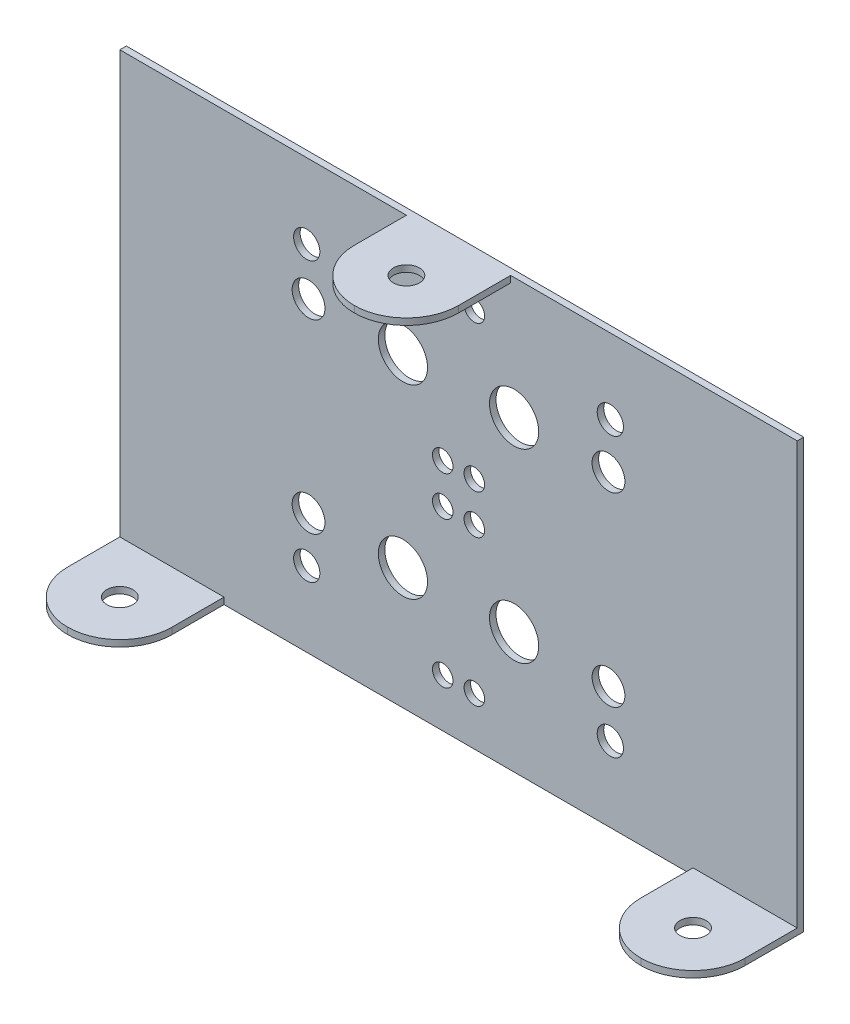
from build123d import *

# Parameters (mm, degrees)
SKETCH1_R             = 1.5875
BOSS_EXTRUDE1_DEPTH   = 1.5875
SKETCH1_W             = 12.7
SKETCH1_H             = 12.7
BOSS_EXTRUDE1_2_DEPTH = 1.5875
SKETCH2_W             = 69.85
SKETCH2_H             = 53
BOSS_EXTRUDE2_DEPTH   = 1.5875
BOSS_EXTRUDE3_DEPTH   = 1.5875
SKETCH6_W             = 1.5875
SKETCH6_H             = 53
BOSS_EXTRUDE4_DEPTH   = 12.7
SKETCH7_W             = 12.7
SKETCH7_H             = 12.7
CUT_EXTRUDE1_DEPTH    = 12.7
SKETCH10_W            = 13.49375
SKETCH10_H            = 0.79375
CUT_EXTRUDE3_DEPTH    = 100.134429722
SKETCH13_R            = 1.25
SKETCH13_R_2          = 3
SKETCH13_R_3          = 2.000000064
CUT_EXTRUDE4_DEPTH    = 12.7
FILLET1_R             = 6.35
FILLET2_R             = 6.35
SKETCH14_W            = 12.7
SKETCH14_H            = 12.7
SKETCH14_R            = 1.5875
BOSS_EXTRUDE5_DEPTH   = 0.79375
FILLET3_R             = 6.35
SKETCH15_R            = 1.6
CUT_EXTRUDE7_DEPTH    = 0.79375


with BuildPart() as part:
    # Sketch1 → Boss-Extrude1 (new body)
    with BuildSketch(Plane(origin=(0, 0, 0), x_dir=(1, 0, 0), z_dir=(0, 1, 0))):
        Polygon((-12.7, 0), (0, 0), (0, 12.7), (-12.7, 12.7), (-12.7, 6.35), align=None)
        with Locations(Location((-6.35, 6.35, 0), (0, 0, 270))):
            Circle(SKETCH1_R, mode=Mode.SUBTRACT)
    extrude(amount=BOSS_EXTRUDE1_DEPTH)



with BuildPart() as body_2:
    # Sketch1 → Boss-Extrude1 2 (new body)
    with BuildSketch(Plane(origin=(0, 0, 0), x_dir=(1, 0, 0), z_dir=(0, 1, 0))):
        with Locations((-63.5, 6.35)):
            Rectangle(SKETCH1_W, SKETCH1_H)
        with Locations(Location((-63.5, 6.35, 0), (0, 0, 270))):
            Circle(SKETCH1_R, mode=Mode.SUBTRACT)
    extrude(amount=BOSS_EXTRUDE1_2_DEPTH)


with BuildPart() as part_1:
    add(part.part)

    add(body_2.part)  # Boss-Extrude2 merges body 2
    # Sketch2 → Boss-Extrude2 (add)
    with BuildSketch(Plane(origin=(0, 0, -12.7), x_dir=(-1, 0, 0), z_dir=(0, 0, -1))):
        with Locations((34.925, 26.5)):
            Rectangle(SKETCH2_W, SKETCH2_H)
    extrude(amount=BOSS_EXTRUDE2_DEPTH)

    # Sketch5 → Boss-Extrude3 (add)
    with BuildSketch(Plane(origin=(0, 1.5875, 0), x_dir=(1, 0, 0), z_dir=(0, 1, 0))):
        with BuildLine():
            Line((-69.85, 0), (-69.85, 6.35))
            Line((-69.85, 6.35), (-74.6125, 6.35))
            ThreePointArc((-74.6125, 6.35), (-76.2, 4.7625), (-77.7875, 6.35))
            Line((-77.7875, 6.35), (-82.55, 6.35))
            Line((-82.55, 6.35), (-82.55, 0))
            Line((-82.55, 0), (-69.85, 0))
        make_face()
        with BuildLine():
            ThreePointArc((-77.7875, 6.35), (-77.322532015, 7.472532015), (-76.2, 7.9375))
            Line((-76.2, 7.9375), (-76.2, 12.7))
            Line((-76.2, 12.7), (-82.55, 12.7))
            Line((-82.55, 12.7), (-82.55, 6.35))
            Line((-82.55, 6.35), (-77.7875, 6.35))
        make_face()
        with BuildLine():
            Line((-74.6125, 6.35), (-69.85, 6.35))
            Line((-69.85, 6.35), (-69.85, 12.7))
            Line((-69.85, 12.7), (-76.2, 12.7))
            Line((-76.2, 12.7), (-76.2, 7.9375))
            ThreePointArc((-76.2, 7.9375), (-75.077467985, 7.472532015), (-74.6125, 6.35))
        make_face()
    extrude(amount=-BOSS_EXTRUDE3_DEPTH)

    # Sketch6 → Boss-Extrude4 (add)
    with BuildSketch(Plane.ZY.offset(69.85)):
        with Locations((-13.49375, 26.5)):
            Rectangle(SKETCH6_W, SKETCH6_H)
    extrude(amount=BOSS_EXTRUDE4_DEPTH)

    # Sketch7 → Cut-Extrude1 (cut)
    with BuildSketch(Plane(origin=(0, 1.5875, 0), x_dir=(1, 0, 0), z_dir=(0, 1, 0))):
        with Locations((-63.5, 6.35)):
            Rectangle(SKETCH7_W, SKETCH7_H)
    extrude(amount=-CUT_EXTRUDE1_DEPTH, mode=Mode.SUBTRACT)

    # Sketch10 → Cut-Extrude3 (cut, through all)
    with BuildSketch(Plane(origin=(0, 0, 0), x_dir=(0, 0, -1), z_dir=(1, 0, 0))):
        with Locations((6.746875, 0.396875)):
            Rectangle(SKETCH10_W, SKETCH10_H)
        Polygon((13.49375, 0.79375), (13.49375, 0), (14.2875, 0), (14.2875, 53), (13.49375, 53), align=None)
    extrude(amount=-CUT_EXTRUDE3_DEPTH, mode=Mode.SUBTRACT)

    # Sketch13 → Cut-Extrude4 (cut)
    with BuildSketch(Plane(origin=(0, 0, -13.49375), x_dir=(-1, 0, 0), z_dir=(0, 0, -1))):
        with Locations((43.2, 24.48749994)):
            Circle(SKETCH13_R)
        with Locations((43.2, 6.68749994)):
            Circle(SKETCH13_R)
        with Locations((34.5, 15.58749994)):
            Circle(SKETCH13_R_2)
        with Locations((23, 15.58749994)):
            Circle(SKETCH13_R_3)
        with Locations((39.35, 6.68749994)):
            Circle(SKETCH13_R)
        with Locations((39.35, 24.48749994)):
            Circle(SKETCH13_R)
        with Locations((48.05, 15.58749994)):
            Circle(SKETCH13_R_2)
        with Locations((59.55, 15.58749994)):
            Circle(SKETCH13_R_3)
        with Locations((59.55, 38.20625006)):
            Circle(SKETCH13_R_3)
        with Locations((48.05, 38.20625006)):
            Circle(SKETCH13_R_2)
        with Locations((39.35, 29.30625006)):
            Circle(SKETCH13_R)
        with Locations(Location((39.35, 47.10625006, 0), (0, 0, 180))):
            Circle(SKETCH13_R)
        with Locations((23, 38.20625006)):
            Circle(SKETCH13_R_3)
        with Locations((34.5, 38.20625006)):
            Circle(SKETCH13_R_2)
        with Locations((43.2, 47.10625006)):
            Circle(SKETCH13_R)
        with Locations((43.2, 29.30625006)):
            Circle(SKETCH13_R)
    extrude(amount=-CUT_EXTRUDE4_DEPTH, mode=Mode.SUBTRACT)

    # Fillet1
    fillet1_edges = [part_1.edges().sort_by_distance(p)[0] for p in [
        (-12.7, 1.190625, 0),
        (0, 1.190625, 0),
    ]]
    fillet(fillet1_edges, radius=FILLET1_R - 0.0001)  # a hair under: the kernel refuses the full size

    # Fillet2
    fillet2_edges = [part_1.edges().sort_by_distance(p)[0] for p in [
        (-82.55, 1.190625, 0),
        (-69.85, 1.190625, 0),
    ]]
    fillet(fillet2_edges, radius=FILLET2_R - 0.0001)  # a hair under: the kernel refuses the full size

    # Sketch14 → Boss-Extrude5 (add)
    with BuildSketch(Plane(origin=(0, 53, 0), x_dir=(1, 0, 0), z_dir=(0, 1, 0))):
        with Locations((-41.275, 6.35)):
            Rectangle(SKETCH14_W, SKETCH14_H)
        with Locations(Location((-41.275, 6.35, 0), (0, 0, 270))):
            Circle(SKETCH14_R, mode=Mode.SUBTRACT)
    extrude(amount=-BOSS_EXTRUDE5_DEPTH)

    # Fillet3
    fillet3_edges = [part_1.edges().sort_by_distance(p)[0] for p in [
        (-47.625, 52.603125, 0),
        (-34.925, 52.603125, 0),
    ]]
    fillet(fillet3_edges, radius=FILLET3_R - 0.0001)  # a hair under: the kernel refuses the full size

    # Sketch15 → Cut-Extrude7 (cut)
    with BuildSketch(Plane(origin=(0, 0, -13.49375), x_dir=(-1, 0, 0), z_dir=(0, 0, -1))):
        with Locations((22.775, 43.862031033)):
            Circle(SKETCH15_R)
        with Locations((22.775, 9.931718967)):
            Circle(SKETCH15_R)
        with Locations((59.775, 9.931718967)):
            Circle(SKETCH15_R)
        with Locations((59.775, 43.862031033)):
            Circle(SKETCH15_R)
    extrude(amount=-CUT_EXTRUDE7_DEPTH, mode=Mode.SUBTRACT)


solid = part_1.part
